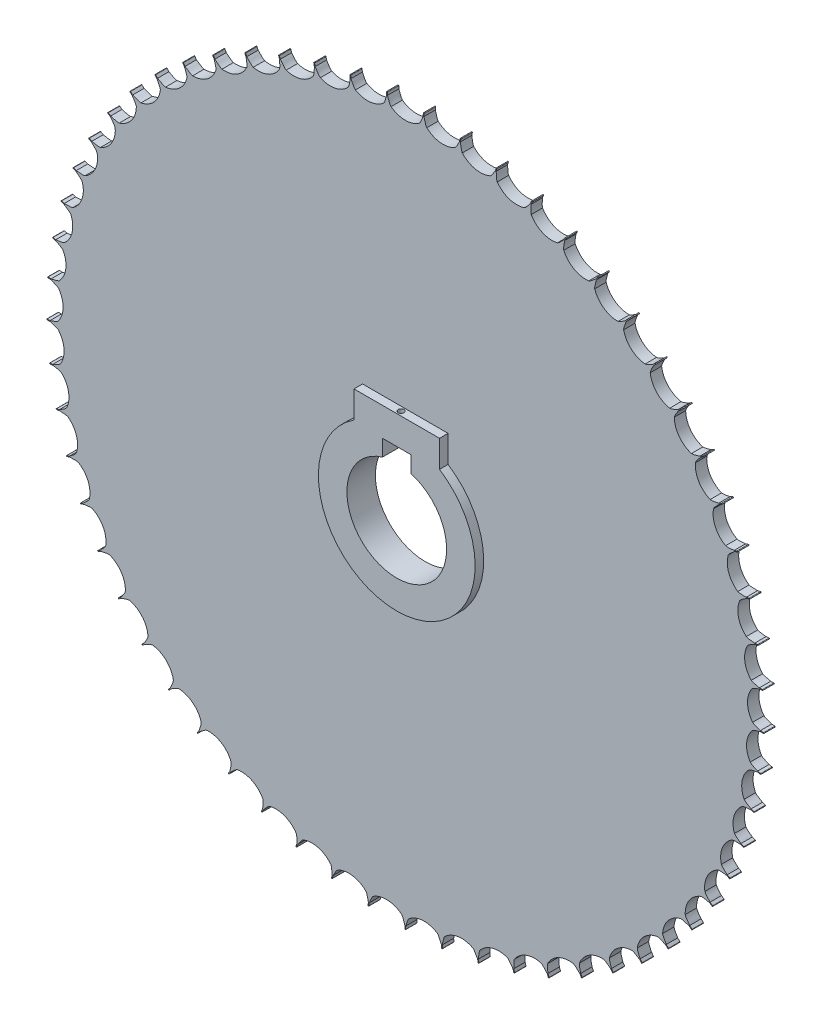
from build123d import *

# Parameters (mm, degrees)
BOSS_EXTRUDE1_DEPTH      = 2
BOSS_EXTRUDE1_DEPTH_BACK = 2
SKETCH1_R                = 121.875
BOSS_EXTRUDE8_DEPTH      = 13
SKETCH3_R                = 125.375
BOSS_EXTRUDE9_DEPTH      = 4
CUT_EXTRUDE1_REACH       = 179.783
CIRPATTERN1_COUNT        = 61
CUT_EXTRUDE4_REACH       = 178.802
BOSS_EXTRUDE12_START     = -7
BOSS_EXTRUDE12_DEPTH     = 10
SKETCH10_R               = 1
CUT_EXTRUDE5_DEPTH       = 10
SKETCH11_W               = 0.3
SKETCH11_H               = 1.7
BOSS_EXTRUDE13_DEPTH     = 4
FILLET1_RADIUS           = 0.15
FILLET1_LENGTH           = 4
CIRPATTERN2_START        = -2
CIRPATTERN2_DEPTH        = 4


with BuildPart() as part:
    # Sketch1 → Boss-Extrude1 (new, two sides: drawn at the far end of the back side and taken through both)
    with BuildSketch(Plane.XY.offset(-BOSS_EXTRUDE1_DEPTH_BACK)):
        Circle(SKETCH1_R)
    extrude(amount=BOSS_EXTRUDE1_DEPTH + BOSS_EXTRUDE1_DEPTH_BACK)

    # Sketch2 → Boss-Extrude8 (add)
    with BuildSketch(Plane.XY.offset(2)):
        with BuildLine():
            ThreePointArc((-5.017560557, 121.766793056), (0.002357444, 120.130259364), (5.022275444, 121.766793056))
            add(Edge.make_bspline(
                [(5.022275444, 121.766793056), (5.19040872, 121.981200196), (5.527488144, 122.5398233), (5.976227316, 123.731681771), (6.274832558, 124.706349674), (6.686666667, 125.196561909)],
                knots=[0.009720621, 0.009720621, 0.009720621, 0.009720621, 0.218523512, 0.511297045, 1, 1, 1, 1], degree=3))
            ThreePointArc((6.686666667, 125.196561909), (0, 125.375), (-6.686666667, 125.196561909))
            add(Edge.make_bspline(
                [(-5.017560557, 121.766793056), (-5.426604904, 122.281885542), (-5.896105794, 123.471658256), (-6.274769094, 124.705861977), (-6.686666667, 125.196561909)],
                knots=[0, 0, 0, 0, 0.507380155, 1, 1, 1, 1], degree=3))
        make_face()
    extrude(amount=-BOSS_EXTRUDE8_DEPTH)

    # Sketch3 → Boss-Extrude9 (add)
    with BuildSketch(Plane.XY.offset(2)):
        Circle(SKETCH3_R)
    extrude(amount=-BOSS_EXTRUDE9_DEPTH)

    # Sketch4 → Cut-Extrude1 (cut, up to next)
    with BuildSketch(Plane(origin=(0, 0, -11), x_dir=(-1, 0, 0), z_dir=(0, 0, -1)), mode=Mode.PRIVATE) as cut_extrude1_sk1:
        with BuildLine():
            ThreePointArc((6.686666667, 125.196561909), (0, 125.375), (-6.686666667, 125.196561909))
            add(Edge.make_bspline(
                [(-6.686666667, 125.196561909), (-6.274832558, 124.706349674), (-5.976227316, 123.731681771), (-5.527488144, 122.5398233), (-5.19040872, 121.981200196), (-5.022275444, 121.766793056)],
                knots=[0.009720621, 0.009720621, 0.009720621, 0.009720621, 0.498423576, 0.791197109, 1, 1, 1, 1], degree=3))
            ThreePointArc((-5.022275444, 121.766793056), (-0.002357444, 120.130259364), (5.017560557, 121.766793056))
            add(Edge.make_bspline(
                [(5.017560557, 121.766793056), (5.426604904, 122.281885542), (5.896105794, 123.471658256), (6.274769094, 124.705861977), (6.686666667, 125.196561909)],
                knots=[0, 0, 0, 0, 0.507380155, 1, 1, 1, 1], degree=3))
        make_face()
    cut_extrude1_tool1 = extrude(cut_extrude1_sk1.sketch, amount=-CUT_EXTRUDE1_REACH, mode=Mode.PRIVATE) & part.part
    cut_extrude1 = cut_extrude1_tool1.solids().sort_by_distance((0.000608, 123.088188, -11))[0]
    add(cut_extrude1, mode=Mode.SUBTRACT)

    # CirPattern1: Cut-Extrude1 ×61 about axis
    cirpattern1_axis = Axis((0, 0, 0), (0, 0, 1))
    for i in range(1, CIRPATTERN1_COUNT):
        add(cut_extrude1.rotate(cirpattern1_axis, i * 360 / CIRPATTERN1_COUNT), mode=Mode.SUBTRACT)

    # Sketch5 → Cut-Extrude4 (cut, up to next)
    with BuildSketch(Plane.XY.offset(2), mode=Mode.PRIVATE) as cut_extrude4_sk1:
        with BuildLine():
            Line((-5, 22.5), (5, 22.5))
            Line((5, 22.5), (5, 16.770509831))
            ThreePointArc((5, 16.770509831), (0, -17.5), (-5, 16.770509831))
            Line((-5, 16.770509831), (-5, 22.5))
        make_face()
    cut_extrude4_tool1 = extrude(cut_extrude4_sk1.sketch, amount=-CUT_EXTRUDE4_REACH, mode=Mode.PRIVATE) & part.part
    add(cut_extrude4_tool1.solids().sort_by_distance((0, 1.026754, 2))[0], mode=Mode.SUBTRACT)

    # Boss-Extrude12: read off the stored shape, not the designer's step
    # Boss-Extrude12 outline → Boss-Extrude12 (add)
    with BuildSketch(Plane.XY.offset(2).offset(BOSS_EXTRUDE12_START)):
        with BuildLine():
            ThreePointArc((-15, 23.048861143), (0, -27.5), (15, 23.048861143))
            Line((15, 23.048861143), (15, 32.5))
            Line((15, 32.5), (-15, 32.5))
            Line((-15, 32.5), (-15, 23.048861143))
        make_face()
        with BuildLine():
            Line((5, 22.5), (5, 16.770509831))
            ThreePointArc((5, 16.770509831), (0, -17.5), (-5, 16.770509831))
            Line((-5, 16.770509831), (-5, 22.5))
            Line((-5, 22.5), (5, 22.5))
        make_face(mode=Mode.SUBTRACT)
    extrude(amount=BOSS_EXTRUDE12_DEPTH)

    # Sketch10 → Cut-Extrude5 (cut)
    with BuildSketch(Plane(origin=(0, 32.5, 0), x_dir=(1, 0, 0), z_dir=(0, 1, 0))):
        with Locations(Location((0, -3.5, 0), (0, 0, 270))):
            Circle(SKETCH10_R)
    extrude(amount=-CUT_EXTRUDE5_DEPTH, mode=Mode.SUBTRACT)

    # Sketch11 → Boss-Extrude13 (add)
    with BuildSketch(Plane.XY.offset(2)):
        with Locations((-6.43520358, 124.840908899)):
            Rectangle(SKETCH11_W, SKETCH11_H)
    extrude(amount=-BOSS_EXTRUDE13_DEPTH)

    # Fillet1: full round fillet: the end face becomes a half cylinder, R = half its width
    fillet1_face = Plane((-6.43520358, 125.690908899, 0), x_dir=(0, 0, -1), z_dir=(0, 1, 0))  # on the end face: x along it, z out of the body
    fillet1_slab = fillet1_face.offset(-FILLET1_RADIUS / 2) * Box(FILLET1_LENGTH, 2 * FILLET1_RADIUS, FILLET1_RADIUS, mode=Mode.PRIVATE)  # the body's end, R deep
    fillet1_round = Plane((-6.43520358, 125.540908899, 0), x_dir=(0, 1, 0), z_dir=(0, 0, -1)) * Cylinder(FILLET1_RADIUS, FILLET1_LENGTH, mode=Mode.PRIVATE)  # its axis R under the face
    add(fillet1_slab - fillet1_round, mode=Mode.SUBTRACT)

    # CirPattern2: read off the stored shape, not the designer's step
    # CirPattern2 outline → CirPattern2 (add)
    with BuildSketch(Plane.XY.offset(CIRPATTERN2_START)):
        with BuildLine():
            Line((6.555554418, 124.546669502), (6.656350216, 125.521777366))
            ThreePointArc((6.656350216, 125.521777366), (6.522568384, 125.686405497), (6.357940253, 125.552623665))
            Line((6.357940253, 125.552623665), (6.24693583, 124.478756571))
            add(Edge.make_bspline(
                [(6.24693583, 124.478756571), (6.303416444, 124.602762202), (6.365316105, 124.723934482), (6.435170536, 124.840910603)],
                knots=[0.781331703, 0.781331703, 0.781331703, 0.781331703, 0.887572547, 0.887572547, 0.887572547, 0.887572547], degree=3))
            add(Edge.make_bspline(
                [(6.555554418, 124.546669502), (6.519654201, 124.646429724), (6.479946404, 124.744675326), (6.435170536, 124.840910603)],
                knots=[0.803239499, 0.803239499, 0.803239499, 0.803239499, 0.886693191, 0.886693191, 0.886693191, 0.886693191], degree=3))
        make_face()
        with BuildLine():
            Line((19.326821912, 123.21250802), (19.527345043, 124.172083767))
            ThreePointArc((19.527345043, 124.172083767), (19.411199499, 124.349594929), (19.233688337, 124.233449386))
            Line((19.233688337, 124.233449386), (19.012856166, 123.176687507))
            add(Edge.make_bspline(
                [(19.237330244, 123.517567597), (19.155818448, 123.408393967), (19.081787808, 123.294228499), (19.012856166, 123.176687507)],
                knots=[0.122148074, 0.122148074, 0.122148074, 0.122148074, 0.228388918, 0.228388918, 0.228388918, 0.228388918], degree=3))
            add(Edge.make_bspline(
                [(19.326821912, 123.21250802), (19.301369417, 123.315430796), (19.271973787, 123.41723848), (19.237330244, 123.517567597)],
                knots=[0.803239499, 0.803239499, 0.803239499, 0.803239499, 0.886693191, 0.886693191, 0.886693191, 0.886693191], degree=3))
        make_face()
        with BuildLine():
            Line((31.893220286, 120.5722633), (32.191345155, 121.506135189))
            ThreePointArc((32.191345155, 121.506135189), (32.094067072, 121.694647721), (31.90555454, 121.597369638))
            Line((31.90555454, 121.597369638), (31.577235497, 120.568914912))
            add(Edge.make_bspline(
                [(31.835569465, 120.884907647), (31.743264351, 120.784693775), (31.657887475, 120.678745303), (31.577235497, 120.568914912)],
                knots=[0.122148074, 0.122148074, 0.122148074, 0.122148074, 0.228388918, 0.228388918, 0.228388918, 0.228388918], degree=3))
            add(Edge.make_bspline(
                [(31.893220286, 120.5722633), (31.878485315, 120.677257625), (31.859713453, 120.781548203), (31.835569465, 120.884907647)],
                knots=[0.803239499, 0.803239499, 0.803239499, 0.803239499, 0.886693191, 0.886693191, 0.886693191, 0.886693191], degree=3))
        make_face()
        with BuildLine():
            Line((44.121542591, 116.653922596), (44.514109, 117.552191351))
            ThreePointArc((44.514109, 117.552191351), (44.436729549, 117.749706972), (44.239213928, 117.672327522))
            Line((44.239213928, 117.672327522), (43.806888276, 116.683081826))
            add(Edge.make_bspline(
                [(44.09634373, 116.970837603), (43.994223754, 116.880645781), (43.898405659, 116.784037385), (43.806888276, 116.683081826)],
                knots=[0.122148074, 0.122148074, 0.122148074, 0.122148074, 0.228388918, 0.228388918, 0.228388918, 0.228388918], degree=3))
            add(Edge.make_bspline(
                [(44.121542591, 116.653922596), (44.117681338, 116.759875502), (44.109732231, 116.865543468), (44.09634373, 116.970837603)],
                knots=[0.803239499, 0.803239499, 0.803239499, 0.803239499, 0.886693191, 0.886693191, 0.886693191, 0.886693191], degree=3))
        make_face()
        with BuildLine():
            Line((55.882165569, 111.499021291), (56.365012215, 112.352165041))
            ThreePointArc((56.365012215, 112.352165041), (56.308351639, 112.556590037), (56.103926643, 112.499929461))
            Line((56.103926643, 112.499929461), (55.572177142, 111.560379044))
            add(Edge.make_bspline(
                [(55.889685782, 111.816847582), (55.778833441, 111.737633865), (55.673589822, 111.651389618), (55.572177142, 111.560379044)],
                knots=[0.122148074, 0.122148074, 0.122148074, 0.122148074, 0.228388918, 0.228388918, 0.228388918, 0.228388918], degree=3))
            add(Edge.make_bspline(
                [(55.882165569, 111.499021291), (55.889218964, 111.604809651), (55.892176874, 111.7107349), (55.889685782, 111.816847582)],
                knots=[0.803239499, 0.803239499, 0.803239499, 0.803239499, 0.886693191, 0.886693191, 0.886693191, 0.886693191], degree=3))
        make_face()
        with BuildLine():
            Line((67.05042369, 105.162202624), (67.61843228, 105.961177831))
            ThreePointArc((67.61843228, 105.961177831), (67.583091194, 106.170345247), (67.373923778, 106.135004161))
            Line((67.373923778, 106.135004161), (66.748387105, 105.255108492))
            add(Edge.make_bspline(
                [(67.09058326, 105.47757116), (66.972173617, 105.410175234), (66.858620083, 105.335209345), (66.748387105, 105.255108492)],
                knots=[0.122148074, 0.122148074, 0.122148074, 0.122148074, 0.228388918, 0.228388918, 0.228388918, 0.228388918], degree=3))
            add(Edge.make_bspline(
                [(67.05042369, 105.162202624), (67.068316966, 105.266705055), (67.082150538, 105.371764752), (67.09058326, 105.47757116)],
                knots=[0.803239499, 0.803239499, 0.803239499, 0.803239499, 0.886693191, 0.886693191, 0.886693191, 0.886693191], degree=3))
        make_face()
        with BuildLine():
            Line((77.507930639, 97.710638447), (78.15508014, 98.446975777))
            ThreePointArc((78.15508014, 98.446975777), (78.141433169, 98.658668385), (77.929740561, 98.645021413))
            Line((77.929740561, 98.645021413), (77.21704756, 97.834107605))
            add(Edge.make_bspline(
                [(77.580303866, 98.020206243), (77.455592093, 97.965342522), (77.33493234, 97.902449649), (77.21704756, 97.834107605)],
                knots=[0.122148074, 0.122148074, 0.122148074, 0.122148074, 0.228388918, 0.228388918, 0.228388918, 0.228388918], degree=3))
            add(Edge.make_bspline(
                [(77.507930639, 97.710638447), (77.536474122, 97.812747198), (77.561036718, 97.915827683), (77.580303866, 98.020206243)],
                knots=[0.803239499, 0.803239499, 0.803239499, 0.803239499, 0.886693191, 0.886693191, 0.886693191, 0.886693191], degree=3))
        make_face()
        with BuildLine():
            Line((87.143834242, 89.223317195), (87.863264709, 89.889211288))
            ThreePointArc((87.863264709, 89.889211288), (87.871456513, 90.101185094), (87.659482707, 90.109376898))
            Line((87.659482707, 90.109376898), (86.867188101, 89.37604084))
            add(Edge.make_bspline(
                [(87.247653951, 89.523802756), (87.117962023, 89.482052808), (86.991475074, 89.431899632), (86.867188101, 89.37604084)],
                knots=[0.122148074, 0.122148074, 0.122148074, 0.122148074, 0.228388918, 0.228388918, 0.228388918, 0.228388918], degree=3))
            add(Edge.make_bspline(
                [(87.143834242, 89.223317195), (87.182725365, 89.321949888), (87.217756614, 89.421958483), (87.247653951, 89.523802756)],
                knots=[0.803239499, 0.803239499, 0.803239499, 0.803239499, 0.886693191, 0.886693191, 0.886693191, 0.886693191], degree=3))
        make_face()
        with BuildLine():
            Line((95.855991523, 79.790206585), (96.640076813, 80.378598799))
            ThreePointArc((96.640076813, 80.378598799), (96.670020558, 80.588606828), (96.460012529, 80.618550572))
            Line((96.460012529, 80.618550572), (95.596514838, 79.970565807))
            add(Edge.make_bspline(
                [(95.9901572, 80.078424689), (95.856859884, 80.050231074), (95.725886531, 80.01334923), (95.596514838, 79.970565807)],
                knots=[0.122148074, 0.122148074, 0.122148074, 0.122148074, 0.228388918, 0.228388918, 0.228388918, 0.228388918], degree=3))
            add(Edge.make_bspline(
                [(95.855991523, 79.790206585), (95.90481803, 79.884317688), (95.949946592, 79.980194277), (95.9901572, 80.078424689)],
                knots=[0.803239499, 0.803239499, 0.803239499, 0.803239499, 0.886693191, 0.886693191, 0.886693191, 0.886693191], degree=3))
        make_face()
        with BuildLine():
            Line((103.552051447, 69.511299935), (104.392480063, 70.015953166))
            ThreePointArc((104.392480063, 70.015953166), (104.443858337, 70.221769281), (104.238042222, 70.273147554))
            Line((104.238042222, 70.273147554), (103.312494737, 69.717382883))
            add(Edge.make_bspline(
                [(103.715140903, 69.784195399), (103.579651184, 69.769856977), (103.445579778, 69.746637422), (103.312494737, 69.717382883)],
                knots=[0.122148074, 0.122148074, 0.122148074, 0.122148074, 0.228388918, 0.228388918, 0.228388918, 0.228388918], degree=3))
            add(Edge.make_bspline(
                [(103.552051447, 69.511299935), (103.610295765, 69.599891847), (103.665043267, 69.690620115), (103.715140903, 69.784195399)],
                knots=[0.803239499, 0.803239499, 0.803239499, 0.803239499, 0.886693191, 0.886693191, 0.886693191, 0.886693191], degree=3))
        make_face()
        with BuildLine():
            Line((110.150433866, 58.495556214), (111.038297053, 58.911121011))
            ThreePointArc((111.038297053, 58.911121011), (111.110565234, 59.110563509), (110.911122736, 59.18283169))
            Line((110.911122736, 59.18283169), (109.93333649, 58.725178356))
            add(Edge.make_bspline(
                [(110.340718311, 58.750236277), (110.204472413, 58.749905038), (110.068724145, 58.740593906), (109.93333649, 58.725178356)],
                knots=[0.122148074, 0.122148074, 0.122148074, 0.122148074, 0.228388918, 0.228388918, 0.228388918, 0.228388918], degree=3))
            add(Edge.make_bspline(
                [(110.150433866, 58.495556214), (110.217478591, 58.577689839), (110.281264695, 58.662308043), (110.340718311, 58.750236277)],
                knots=[0.803239499, 0.803239499, 0.803239499, 0.803239499, 0.886693191, 0.886693191, 0.886693191, 0.886693191], degree=3))
        make_face()
        with BuildLine():
            Line((115.581194284, 46.859745045), (116.507080472, 47.181816319))
            ThreePointArc((116.507080472, 47.181816319), (116.599472499, 47.37277106), (116.408517758, 47.465163087))
            Line((116.408517758, 47.465163087), (115.388857528, 47.11047233))
            add(Edge.make_bspline(
                [(115.796656655, 47.093510036), (115.661098819, 47.107189492), (115.525112654, 47.111885481), (115.388857528, 47.11047233)],
                knots=[0.122148074, 0.122148074, 0.122148074, 0.122148074, 0.228388918, 0.228388918, 0.228388918, 0.228388918], degree=3))
            add(Edge.make_bspline(
                [(115.581194284, 46.859745045), (115.656328724, 46.934549746), (115.728477282, 47.012160912), (115.796656655, 47.093510036)],
                knots=[0.803239499, 0.803239499, 0.803239499, 0.803239499, 0.886693191, 0.886693191, 0.886693191, 0.886693191], degree=3))
        make_face()
        with BuildLine():
            Line((119.786765288, 34.727208921), (120.740859855, 34.952372636))
            ThreePointArc((120.740859855, 34.952372636), (120.85239635, 35.132815454), (120.671953532, 35.244351948))
            Line((120.671953532, 35.244351948), (119.621227971, 34.996383577))
            add(Edge.make_bspline(
                [(120.025121632, 34.937580872), (119.891688805, 34.965126017), (119.756906229, 34.983779351), (119.621227971, 34.996383577)],
                knots=[0.122148074, 0.122148074, 0.122148074, 0.122148074, 0.228388918, 0.228388918, 0.228388918, 0.228388918], degree=3))
            add(Edge.make_bspline(
                [(119.786765288, 34.727208921), (119.869193001, 34.79389175), (119.94893922, 34.86367318), (120.025121632, 34.937580872)],
                knots=[0.803239499, 0.803239499, 0.803239499, 0.803239499, 0.886693191, 0.886693191, 0.886693191, 0.886693191], degree=3))
        make_face()
        with BuildLine():
            Line((122.722566781, 22.226555743), (123.694756086, 22.352425108))
            ThreePointArc((123.694756086, 22.352425108), (123.824254734, 22.520443263), (123.656236579, 22.64994191))
            Line((123.656236579, 22.64994191), (122.58558364, 22.511324452))
            add(Edge.make_bspline(
                [(122.981290461, 22.41130466), (122.851397063, 22.452423509), (122.719246807, 22.484836456), (122.58558364, 22.511324452)],
                knots=[0.122148074, 0.122148074, 0.122148074, 0.122148074, 0.228388918, 0.228388918, 0.228388918, 0.228388918], degree=3))
            add(Edge.make_bspline(
                [(122.722566781, 22.226555743), (122.811414012, 22.284409845), (122.897912562, 22.34562184), (122.981290461, 22.41130466)],
                knots=[0.803239499, 0.803239499, 0.803239499, 0.803239499, 0.886693191, 0.886693191, 0.886693191, 0.886693191], degree=3))
        make_face()
        with BuildLine():
            Line((124.357478537, 9.490295545), (125.337457131, 9.515536313))
            ThreePointArc((125.337457131, 9.515536313), (125.483545214, 9.66934877), (125.329732757, 9.815436853))
            Line((125.329732757, 9.815436853), (124.250501625, 9.787639688))
            add(Edge.make_bspline(
                [(124.633827017, 9.647463044), (124.508849951, 9.701719726), (124.380732839, 9.747548702), (124.250501625, 9.787639688)],
                knots=[0.122148074, 0.122148074, 0.122148074, 0.122148074, 0.228388918, 0.228388918, 0.228388918, 0.228388918], degree=3))
            add(Edge.make_bspline(
                [(124.357478537, 9.490295545), (124.451803483, 9.538707653), (124.544137458, 9.590701349), (124.633827017, 9.647463044)],
                knots=[0.803239499, 0.803239499, 0.803239499, 0.803239499, 0.886693191, 0.886693191, 0.886693191, 0.886693191], degree=3))
        make_face()
        with BuildLine():
            Line((124.674170084, -3.346564146), (125.65154995, -3.422219534))
            ThreePointArc((125.65154995, -3.422219534), (125.812678898, -3.284243224), (125.674702589, -3.123114276))
            Line((125.674702589, -3.123114276), (124.598333384, -3.039796492))
            add(Edge.make_bspline(
                [(124.965214001, -3.218644082), (124.846478056, -3.1518247), (124.723752161, -3.093065494), (124.598333384, -3.039796492)],
                knots=[0.122148074, 0.122148074, 0.122148074, 0.122148074, 0.228388918, 0.228388918, 0.228388918, 0.228388918], degree=3))
            add(Edge.make_bspline(
                [(124.674170084, -3.346564146), (124.772972876, -3.308107214), (124.870163514, -3.265882962), (124.965214001, -3.218644082)],
                knots=[0.803239499, 0.803239499, 0.803239499, 0.803239499, 0.886693191, 0.886693191, 0.886693191, 0.886693191], degree=3))
        make_face()
        with BuildLine():
            Line((123.669284412, -16.147949425), (124.633705081, -16.323699002))
            ThreePointArc((124.633705081, -16.323699002), (124.808166888, -16.203021424), (124.687489309, -16.028559617))
            Line((124.687489309, -16.028559617), (123.625391813, -15.835010073))
            add(Edge.make_bspline(
                [(123.971938629, -16.050632779), (123.860702434, -15.971959), (123.744668682, -15.900892426), (123.625391813, -15.835010073)],
                knots=[0.122148074, 0.122148074, 0.122148074, 0.122148074, 0.228388918, 0.228388918, 0.228388918, 0.228388918], degree=3))
            add(Edge.make_bspline(
                [(123.669284412, -16.147949425), (123.771517718, -16.119855321), (123.872534773, -16.087848102), (123.971938629, -16.050632779)],
                knots=[0.803239499, 0.803239499, 0.803239499, 0.803239499, 0.886693191, 0.886693191, 0.886693191, 0.886693191], degree=3))
        make_face()
        with BuildLine():
            Line((121.35347356, -28.778162423), (122.294711933, -29.052143201))
            ThreePointArc((122.294711933, -29.052143201), (122.480657259, -28.950043565), (122.378557624, -28.764098239))
            Line((122.378557624, -28.764098239), (121.341990333, -28.462368607))
            add(Edge.make_bspline(
                [(121.664529867, -28.712480775), (121.561972554, -28.622786561), (121.453860932, -28.540165943), (121.341990333, -28.462368607)],
                knots=[0.122148074, 0.122148074, 0.122148074, 0.122148074, 0.228388918, 0.228388918, 0.228388918, 0.228388918], degree=3))
            add(Edge.make_bspline(
                [(121.35347356, -28.778162423), (121.458053681, -28.760728952), (121.561826347, -28.739278049), (121.664529867, -28.712480775)],
                knots=[0.803239499, 0.803239499, 0.803239499, 0.803239499, 0.886693191, 0.886693191, 0.886693191, 0.886693191], degree=3))
        make_face()
        with BuildLine():
            Line((117.7512857, -41.10331974), (118.659364415, -41.472627454))
            ThreePointArc((118.659364415, -41.472627454), (118.854822195, -41.390188043), (118.772382783, -41.194730263))
            Line((118.772382783, -41.194730263), (117.77233357, -40.788018954))
            add(Edge.make_bspline(
                [(118.067446822, -41.069969333), (117.974655524, -40.970205464), (117.875612041, -40.8769066), (117.77233357, -40.788018954)],
                knots=[0.122148074, 0.122148074, 0.122148074, 0.122148074, 0.228388918, 0.228388918, 0.228388918, 0.228388918], degree=3))
            add(Edge.make_bspline(
                [(117.7512857, -41.10331974), (117.85710406, -41.096731701), (117.962532321, -41.086064499), (118.067446822, -41.069969333)],
                knots=[0.803239499, 0.803239499, 0.803239499, 0.803239499, 0.886693191, 0.886693191, 0.886693191, 0.886693191], degree=3))
        make_face()
        with BuildLine():
            Line((112.900904918, -52.992771643), (113.766198116, -53.453491538))
            ThreePointArc((113.766198116, -53.453491538), (113.969096447, -53.39158623), (113.907191139, -53.188687899))
            Line((113.907191139, -53.188687899), (112.954260773, -52.681306153))
            add(Edge.make_bspline(
                [(113.218819468, -52.992105999), (113.136777797, -52.883329997), (113.047852338, -52.780341879), (112.954260773, -52.681306153)],
                knots=[0.122148074, 0.122148074, 0.122148074, 0.122148074, 0.228388918, 0.228388918, 0.228388918, 0.228388918], degree=3))
            add(Edge.make_bspline(
                [(112.900904918, -52.992771643), (113.006839816, -52.99709887), (113.112806107, -52.997328445), (113.218819468, -52.992105999)],
                knots=[0.803239499, 0.803239499, 0.803239499, 0.803239499, 0.886693191, 0.886693191, 0.886693191, 0.886693191], degree=3))
        make_face()
        with BuildLine():
            Line((106.853746457, -64.320486983), (107.667081814, -64.867735315))
            ThreePointArc((107.667081814, -64.867735315), (107.875269925, -64.827020322), (107.834554931, -64.618832211))
            Line((107.834554931, -64.618832211), (106.938844712, -64.016158401))
            add(Edge.make_bspline(
                [(107.170044463, -64.352513158), (107.09962208, -64.235878076), (107.021757278, -64.124292404), (106.938844712, -64.016158401)],
                knots=[0.122148074, 0.122148074, 0.122148074, 0.122148074, 0.228388918, 0.228388918, 0.228388918, 0.228388918], degree=3))
            add(Edge.make_bspline(
                [(106.853746457, -64.320486983), (106.958674957, -64.335683607), (107.064056008, -64.346807525), (107.170044463, -64.352513158)],
                knots=[0.803239499, 0.803239499, 0.803239499, 0.803239499, 0.886693191, 0.886693191, 0.886693191, 0.886693191], degree=3))
        make_face()
        with BuildLine():
            Line((99.673911702, -74.96638916), (100.426667661, -75.59436496))
            ThreePointArc((100.426667661, -75.59436496), (100.637938705, -75.575271871), (100.618845615, -75.364000827))
            Line((100.618845615, -75.364000827), (99.789850294, -74.672423445))
            add(Edge.make_bspline(
                [(99.985240326, -75.030767668), (99.927183725, -74.907509867), (99.861204967, -74.788509477), (99.789850294, -74.672423445)],
                knots=[0.122148074, 0.122148074, 0.122148074, 0.122148074, 0.228388918, 0.228388918, 0.228388918, 0.228388918], degree=3))
            add(Edge.make_bspline(
                [(99.673911702, -74.96638916), (99.776721536, -74.992294093), (99.880400282, -75.014194438), (99.985240326, -75.030767668)],
                knots=[0.803239499, 0.803239499, 0.803239499, 0.803239499, 0.886693191, 0.886693191, 0.886693191, 0.886693191], degree=3))
        make_face()
        with BuildLine():
            Line((91.437508687, -84.817628963), (92.121705848, -85.519675531))
            ThreePointArc((92.121705848, -85.519675531), (92.333820299, -85.522406736), (92.336551504, -85.310292285))
            Line((92.336551504, -85.310292285), (91.583058638, -84.537142224))
            add(Edge.make_bspline(
                [(91.740567768, -84.913677376), (91.695492365, -84.78510342), (91.642099041, -84.659949744), (91.583058638, -84.537142224)],
                knots=[0.122148074, 0.122148074, 0.122148074, 0.122148074, 0.228388918, 0.228388918, 0.228388918, 0.228388918], degree=3))
            add(Edge.make_bspline(
                [(91.437508687, -84.817628963), (91.537110045, -84.853967606), (91.637987465, -84.886412228), (91.740567768, -84.913677376)],
                knots=[0.803239499, 0.803239499, 0.803239499, 0.803239499, 0.886693191, 0.886693191, 0.886693191, 0.886693191], degree=3))
        make_face()
        with BuildLine():
            Line((82.231845332, -93.769780798), (82.840231035, -94.538456267))
            ThreePointArc((82.840231035, -94.538456267), (83.050940429, -94.562982816), (83.075466977, -94.352273422))
            Line((83.075466977, -94.352273422), (82.405463777, -93.505746265))
            add(Edge.make_bspline(
                [(82.523422369, -93.89648098), (82.491805973, -93.763953783), (82.451564067, -93.633973483), (82.405463777, -93.505746265)],
                knots=[0.122148074, 0.122148074, 0.122148074, 0.122148074, 0.228388918, 0.228388918, 0.228388918, 0.228388918], degree=3))
            add(Edge.make_bspline(
                [(82.231845332, -93.769780798), (82.327182415, -93.816167953), (82.424189184, -93.858812932), (82.523422369, -93.89648098)],
                knots=[0.803239499, 0.803239499, 0.803239499, 0.803239499, 0.886693191, 0.886693191, 0.886693191, 0.886693191], degree=3))
        make_face()
        with BuildLine():
            Line((72.154503961, -101.72794963), (72.680629166, -102.555105848))
            ThreePointArc((72.680629166, -102.555105848), (72.887699929, -102.601167753), (72.933761834, -102.39409699))
            Line((72.933761834, -102.39409699), (72.354350499, -101.483166134))
            add(Edge.make_bspline(
                [(72.431508164, -101.883958527), (72.413685918, -101.748882911), (72.387022002, -101.61545381), (72.354350499, -101.483166134)],
                knots=[0.122148074, 0.122148074, 0.122148074, 0.122148074, 0.228388918, 0.228388918, 0.228388918, 0.228388918], degree=3))
            add(Edge.make_bspline(
                [(72.154503961, -101.72794963), (72.244566171, -101.783893581), (72.336673994, -101.836286869), (72.431508164, -101.883958527)],
                knots=[0.803239499, 0.803239499, 0.803239499, 0.803239499, 0.886693191, 0.886693191, 0.886693191, 0.886693191], degree=3))
        make_face()
        with BuildLine():
            Line((61.312306897, -108.607776888), (61.750594546, -109.484645794))
            ThreePointArc((61.750594546, -109.484645794), (61.951831677, -109.551754787), (62.01894067, -109.350517656))
            Line((62.01894067, -109.350517656), (61.536263107, -108.384839196))
            add(Edge.make_bspline(
                [(61.571801953, -108.791440767), (61.567962776, -108.655248568), (61.555159496, -108.519785047), (61.536263107, -108.384839196)],
                knots=[0.122148074, 0.122148074, 0.122148074, 0.122148074, 0.228388918, 0.228388918, 0.228388918, 0.228388918], degree=3))
            add(Edge.make_bspline(
                [(61.312306897, -108.607776888), (61.396139554, -108.672684616), (61.482372063, -108.734270831), (61.571801953, -108.791440767)],
                knots=[0.803239499, 0.803239499, 0.803239499, 0.803239499, 0.886693191, 0.886693191, 0.886693191, 0.886693191], degree=3))
        make_face()
        with BuildLine():
            Line((49.820184128, -114.336334694), (50.165988262, -115.253621258))
            ThreePointArc((50.165988262, -115.253621258), (50.359258598, -115.341065968), (50.446703308, -115.147795632))
            Line((50.446703308, -115.147795632), (50.065876018, -114.137606))
            add(Edge.make_bspline(
                [(50.059419324, -114.545706671), (50.069603914, -114.40984156), (50.070796986, -114.273779566), (50.065876018, -114.137606)],
                knots=[0.122148074, 0.122148074, 0.122148074, 0.122148074, 0.228388918, 0.228388918, 0.228388918, 0.228388918], degree=3))
            add(Edge.make_bspline(
                [(49.820184128, -114.336334694), (49.896898584, -114.40951816), (49.976341694, -114.479644472), (50.059419324, -114.545706671)],
                knots=[0.803239499, 0.803239499, 0.803239499, 0.803239499, 0.886693191, 0.886693191, 0.886693191, 0.886693191], degree=3))
        make_face()
        with BuildLine():
            Line((37.799955013, -118.852898907), (38.049610023, -119.800879665))
            ThreePointArc((38.049610023, -119.800879665), (38.232864849, -119.907733155), (38.33971834, -119.724478329))
            Line((38.33971834, -119.724478329), (38.064778188, -118.680485786))
            add(Edge.make_bspline(
                [(38.016394398, -119.085759589), (38.040494793, -118.95166177), (38.055671573, -118.816443594), (38.064778188, -118.680485786)],
                knots=[0.122148074, 0.122148074, 0.122148074, 0.122148074, 0.228388918, 0.228388918, 0.228388918, 0.228388918], degree=3))
            add(Edge.make_bspline(
                [(37.799955013, -118.852898907), (37.868738076, -118.933582349), (37.94054967, -119.011505403), (38.016394398, -119.085759589)],
                knots=[0.803239499, 0.803239499, 0.803239499, 0.803239499, 0.886693191, 0.886693191, 0.886693191, 0.886693191], degree=3))
        make_face()
        with BuildLine():
            Line((25.379036971, -122.109592826), (25.529896452, -123.078218944))
            ThreePointArc((25.529896452, -123.078218944), (25.701193223, -123.203348542), (25.826322821, -123.032051771))
            Line((25.826322821, -123.032051771), (25.660184239, -121.965322898))
            add(Edge.make_bspline(
                [(25.570386233, -122.363473831), (25.608146965, -122.232564772), (25.637146573, -122.099623762), (25.660184239, -121.965322898)],
                knots=[0.122148074, 0.122148074, 0.122148074, 0.122148074, 0.228388918, 0.228388918, 0.228388918, 0.228388918], degree=3))
            add(Edge.make_bspline(
                [(25.379036971, -122.109592826), (25.439159523, -122.196920978), (25.502578381, -122.28181477), (25.570386233, -122.363473831)],
                knots=[0.803239499, 0.803239499, 0.803239499, 0.803239499, 0.886693191, 0.886693191, 0.886693191, 0.886693191], degree=3))
        make_face()
        with BuildLine():
            Line((12.689094824, -124.071894683), (12.739559627, -125.050898485))
            ThreePointArc((12.739559627, -125.050898485), (12.897082554, -125.192977785), (13.039161854, -125.035454858))
            Line((13.039161854, -125.035454858), (12.983585955, -123.957297246))
            add(Edge.make_bspline(
                [(12.853325613, -124.344104809), (12.904346408, -124.217772181), (12.946861442, -124.088517543), (12.983585955, -123.957297246)],
                knots=[0.122148074, 0.122148074, 0.122148074, 0.122148074, 0.228388918, 0.228388918, 0.228388918, 0.228388918], degree=3))
            add(Edge.make_bspline(
                [(12.689094824, -124.071894683), (12.739919552, -124.164941846), (12.794273417, -124.255906481), (12.853325613, -124.344104809)],
                knots=[0.803239499, 0.803239499, 0.803239499, 0.803239499, 0.886693191, 0.886693191, 0.886693191, 0.886693191], degree=3))
        make_face()
        with BuildLine():
            Line((-0.135354885, -124.719003591), (-0.185819698, -125.698007392))
            ThreePointArc((-0.185819698, -125.698007392), (-0.043740398, -125.855530319), (0.113782529, -125.713451019))
            Line((0.113782529, -125.713451019), (0.169358429, -124.635293407))
            add(Edge.make_bspline(
                [(1.6544e-05, -125.006657343), (0.063756569, -124.886240303), (0.119336359, -124.762042169), (0.169358429, -124.635293407)],
                knots=[0.122148074, 0.122148074, 0.122148074, 0.122148074, 0.228388918, 0.228388918, 0.228388918, 0.228388918], degree=3))
            add(Edge.make_bspline(
                [(-0.135354885, -124.719003591), (-0.094366737, -124.816783442), (-0.049654028, -124.912854671), (1.6544e-05, -125.006657343)],
                knots=[0.803239499, 0.803239499, 0.803239499, 0.803239499, 0.886693191, 0.886693191, 0.886693191, 0.886693191], degree=3))
        make_face()
        with BuildLine():
            Line((-12.958369798, -124.044060034), (-13.109229289, -125.012686151))
            ThreePointArc((-13.109229289, -125.012686151), (-12.984099691, -125.183982922), (-12.81280292, -125.058853324))
            Line((-12.81280292, -125.058853324), (-12.646664338, -123.992124451))
            add(Edge.make_bspline(
                [(-12.853292701, -124.344108211), (-12.777509105, -124.230883209), (-12.709453719, -124.11305811), (-12.646664338, -123.992124451)],
                knots=[0.122148074, 0.122148074, 0.122148074, 0.122148074, 0.228388918, 0.228388918, 0.228388918, 0.228388918], degree=3))
            add(Edge.make_bspline(
                [(-12.958369798, -124.044060034), (-12.927652714, -124.145536082), (-12.893055128, -124.245695527), (-12.853292701, -124.344108211)],
                knots=[0.803239499, 0.803239499, 0.803239499, 0.803239499, 0.886693191, 0.886693191, 0.886693191, 0.886693191], degree=3))
        make_face()
        with BuildLine():
            Line((-25.644022768, -122.054218583), (-25.893677788, -123.002199338))
            ThreePointArc((-25.893677788, -123.002199338), (-25.786824298, -123.185454165), (-25.603569471, -123.078600674))
            Line((-25.603569471, -123.078600674), (-25.328629318, -122.034608131))
            add(Edge.make_bspline(
                [(-25.570353845, -122.363480599), (-25.483330004, -122.258647848), (-25.403520426, -122.14844476), (-25.328629318, -122.034608131)],
                knots=[0.122148074, 0.122148074, 0.122148074, 0.122148074, 0.228388918, 0.228388918, 0.228388918, 0.228388918], degree=3))
            add(Edge.make_bspline(
                [(-25.644022768, -122.054218583), (-25.623902357, -122.158315156), (-25.599786636, -122.261501102), (-25.570353845, -122.363480599)],
                knots=[0.803239499, 0.803239499, 0.803239499, 0.803239499, 0.886693191, 0.886693191, 0.886693191, 0.886693191], degree=3))
        make_face()
        with BuildLine():
            Line((-38.057842718, -118.770572051), (-38.403646861, -119.687858612))
            ThreePointArc((-38.403646861, -119.687858612), (-38.316202151, -119.881128948), (-38.122931815, -119.793684238))
            Line((-38.122931815, -119.793684238), (-37.742104525, -118.783494606))
            add(Edge.make_bspline(
                [(-38.016362878, -119.085769652), (-37.919021266, -118.990440406), (-37.828303497, -118.889027508), (-37.742104525, -118.783494606)],
                knots=[0.122148074, 0.122148074, 0.122148074, 0.122148074, 0.228388918, 0.228388918, 0.228388918, 0.228388918], degree=3))
            add(Edge.make_bspline(
                [(-38.057842718, -118.770572051), (-38.04853226, -118.8761857), (-38.035154038, -118.981304351), (-38.016362878, -119.085769652)],
                knots=[0.803239499, 0.803239499, 0.803239499, 0.803239499, 0.886693191, 0.886693191, 0.886693191, 0.886693191], degree=3))
        make_face()
        with BuildLine():
            Line((-50.068240066, -114.227927909), (-50.506527724, -115.10479681))
            ThreePointArc((-50.506527724, -115.10479681), (-50.43941873, -115.306033941), (-50.238181599, -115.238924948))
            Line((-50.238181599, -115.238924948), (-49.755504035, -114.273246488))
            add(Edge.make_bspline(
                [(-50.059389006, -114.545719921), (-49.952761469, -114.460904694), (-49.852097141, -114.369356988), (-49.755504035, -114.273246488)],
                knots=[0.122148074, 0.122148074, 0.122148074, 0.122148074, 0.228388918, 0.228388918, 0.228388918, 0.228388918], degree=3))
            add(Edge.make_bspline(
                [(-50.068240066, -114.227927909), (-50.069838256, -114.333939103), (-50.067339344, -114.439876174), (-50.059389006, -114.545719921)],
                knots=[0.803239499, 0.803239499, 0.803239499, 0.803239499, 0.886693191, 0.886693191, 0.886693191, 0.886693191], degree=3))
        make_face()
        with BuildLine():
            Line((-61.547901615, -108.474439314), (-62.074026828, -109.301595527))
            ThreePointArc((-62.074026828, -109.301595527), (-62.027964923, -109.50866629), (-61.82089416, -109.462604385))
            Line((-61.82089416, -109.462604385), (-61.241482825, -108.55167353))
            add(Edge.make_bspline(
                [(-61.571773158, -108.791457064), (-61.456989974, -108.718054918), (-61.347446152, -108.637342833), (-61.241482825, -108.55167353)],
                knots=[0.122148074, 0.122148074, 0.122148074, 0.122148074, 0.228388918, 0.228388918, 0.228388918, 0.228388918], degree=3))
            add(Edge.make_bspline(
                [(-61.547901615, -108.474439314), (-61.560391511, -108.579724308), (-61.568798399, -108.68535684), (-61.571773158, -108.791457064)],
                knots=[0.803239499, 0.803239499, 0.803239499, 0.803239499, 0.886693191, 0.886693191, 0.886693191, 0.886693191], degree=3))
        make_face()
        with BuildLine():
            Line((-72.375140094, -101.571094677), (-72.983525805, -102.33977014))
            ThreePointArc((-72.983525805, -102.33977014), (-72.958999257, -102.550479534), (-72.748289863, -102.525952985))
            Line((-72.748289863, -102.525952985), (-72.078286662, -101.679425828))
            add(Edge.make_bspline(
                [(-72.431481197, -101.883977698), (-72.309759096, -101.822766714), (-72.192496973, -101.753745818), (-72.078286662, -101.679425828)],
                knots=[0.122148074, 0.122148074, 0.122148074, 0.122148074, 0.228388918, 0.228388918, 0.228388918, 0.228388918], degree=3))
            add(Edge.make_bspline(
                [(-72.375140094, -101.571094677), (-72.398389301, -101.674537424), (-72.417612873, -101.778745686), (-72.431481197, -101.883977698)],
                knots=[0.803239499, 0.803239499, 0.803239499, 0.803239499, 0.886693191, 0.886693191, 0.886693191, 0.886693191], degree=3))
        make_face()
        with BuildLine():
            Line((-82.435184085, -93.591071169), (-83.119381253, -94.293117731))
            ThreePointArc((-83.119381253, -94.293117731), (-83.116650048, -94.505232183), (-82.904535596, -94.502500978))
            Line((-82.904535596, -94.502500978), (-82.151042729, -93.729350917))
            add(Edge.make_bspline(
                [(-82.523397516, -93.896502823), (-82.396026784, -93.848131852), (-82.272289367, -93.791533784), (-82.151042729, -93.729350917)],
                knots=[0.122148074, 0.122148074, 0.122148074, 0.122148074, 0.228388918, 0.228388918, 0.228388918, 0.228388918], degree=3))
            add(Edge.make_bspline(
                [(-82.435184085, -93.591071169), (-82.468946154, -93.69157515), (-82.498782636, -93.793254508), (-82.523397516, -93.896502823)],
                knots=[0.803239499, 0.803239499, 0.803239499, 0.803239499, 0.886693191, 0.886693191, 0.886693191, 0.886693191], degree=3))
        make_face()
        with BuildLine():
            Line((-91.621394616, -84.618959024), (-92.374150582, -85.246934817))
            ThreePointArc((-92.374150582, -85.246934817), (-92.393243672, -85.458205861), (-92.181972628, -85.477298951))
            Line((-92.181972628, -85.477298951), (-91.352977307, -84.785721569))
            add(Edge.make_bspline(
                [(-91.740545293, -84.913701659), (-91.608876089, -84.878683446), (-91.479975027, -84.835108159), (-91.352977307, -84.785721569)],
                knots=[0.122148074, 0.122148074, 0.122148074, 0.122148074, 0.228388918, 0.228388918, 0.228388918, 0.228388918], degree=3))
            add(Edge.make_bspline(
                [(-91.621394616, -84.618959024), (-91.665311661, -84.715458872), (-91.70544478, -84.813531499), (-91.740545293, -84.913701659)],
                knots=[0.803239499, 0.803239499, 0.803239499, 0.803239499, 0.886693191, 0.886693191, 0.886693191, 0.886693191], degree=3))
        make_face()
        with BuildLine():
            Line((-99.836395572, -74.749864862), (-100.649730934, -75.297113186))
            ThreePointArc((-100.649730934, -75.297113186), (-100.690445928, -75.505301296), (-100.482257818, -75.54601629))
            Line((-100.482257818, -75.54601629), (-99.586547599, -74.943342481))
            add(Edge.make_bspline(
                [(-99.985220467, -75.030794133), (-99.850648519, -75.00949988), (-99.717950193, -74.979409283), (-99.586547599, -74.943342481)],
                knots=[0.122148074, 0.122148074, 0.122148074, 0.122148074, 0.228388918, 0.228388918, 0.228388918, 0.228388918], degree=3))
            add(Edge.make_bspline(
                [(-99.836395572, -74.749864862), (-99.890002062, -74.841337654), (-99.940006395, -74.934763957), (-99.985220467, -75.030794133)],
                knots=[0.803239499, 0.803239499, 0.803239499, 0.803239499, 0.886693191, 0.886693191, 0.886693191, 0.886693191], degree=3))
        make_face()
        with BuildLine():
            Line((-106.993105898, -64.088403537), (-107.8583991, -64.549123424))
            ThreePointArc((-107.8583991, -64.549123424), (-107.920304409, -64.752021755), (-107.717406078, -64.813927064))
            Line((-107.717406078, -64.813927064), (-106.764475712, -64.306545318))
            add(Edge.make_bspline(
                [(-107.17002743, -64.352541524), (-107.033979234, -64.345196955), (-106.898890281, -64.328910016), (-106.764475712, -64.306545318)],
                knots=[0.122148074, 0.122148074, 0.122148074, 0.122148074, 0.228388918, 0.228388918, 0.228388918, 0.228388918], degree=3))
            add(Edge.make_bspline(
                [(-106.993105898, -64.088403537), (-107.055833591, -64.173879639), (-107.11517908, -64.261669276), (-107.17002743, -64.352541524)],
                knots=[0.803239499, 0.803239499, 0.803239499, 0.803239499, 0.886693191, 0.886693191, 0.886693191, 0.886693191], degree=3))
        make_face()
        with BuildLine():
            Line((-113.015662685, -52.747589192), (-113.923741404, -53.116896896))
            ThreePointArc((-113.923741404, -53.116896896), (-114.006180815, -53.312354675), (-113.810723036, -53.394794086))
            Line((-113.810723036, -53.394794086), (-112.810673823, -52.988082778))
            add(Edge.make_bspline(
                [(-113.218805442, -52.992135966), (-113.082723143, -52.998818935), (-112.946675539, -52.9965083), (-112.810673823, -52.988082778)],
                knots=[0.122148074, 0.122148074, 0.122148074, 0.122148074, 0.228388918, 0.228388918, 0.228388918, 0.228388918], degree=3))
            add(Edge.make_bspline(
                [(-113.015662685, -52.747589192), (-113.086846651, -52.826162536), (-113.154904221, -52.907384914), (-113.218805442, -52.992135966)],
                knots=[0.803239499, 0.803239499, 0.803239499, 0.803239499, 0.886693191, 0.886693191, 0.886693191, 0.886693191], degree=3))
        make_face()
        with BuildLine():
            Line((-117.840225333, -40.847637278), (-118.781463708, -41.121618047))
            ThreePointArc((-118.781463708, -41.121618047), (-118.883563344, -41.307563374), (-118.697618017, -41.409663009))
            Line((-118.697618017, -41.409663009), (-117.661050727, -41.107933378))
            add(Edge.make_bspline(
                [(-118.067435951, -41.070000583), (-117.932762054, -41.09064025), (-117.797197938, -41.102330412), (-117.661050727, -41.107933378)],
                knots=[0.122148074, 0.122148074, 0.122148074, 0.122148074, 0.228388918, 0.228388918, 0.228388918, 0.228388918], degree=3))
            add(Edge.make_bspline(
                [(-117.840225333, -40.847637278), (-117.919111005, -40.918474968), (-117.995159226, -40.99226911), (-118.067435951, -41.070000583)],
                knots=[0.803239499, 0.803239499, 0.803239499, 0.803239499, 0.886693191, 0.886693191, 0.886693191, 0.886693191], degree=3))
        make_face()
        with BuildLine():
            Line((-121.415652276, -28.514690248), (-122.380072947, -28.690439816))
            ThreePointArc((-122.380072947, -28.690439816), (-122.500750526, -28.864901623), (-122.326288719, -28.985579202))
            Line((-122.326288719, -28.985579202), (-121.264191223, -28.792029658))
            add(Edge.make_bspline(
                [(-121.664522267, -28.712512978), (-121.53268435, -28.746890556), (-121.399040734, -28.772457596), (-121.264191223, -28.792029658)],
                knots=[0.122148074, 0.122148074, 0.122148074, 0.122148074, 0.228388918, 0.228388918, 0.228388918, 0.228388918], degree=3))
            add(Edge.make_bspline(
                [(-121.415652276, -28.514690248), (-121.501403446, -28.577041386), (-121.58463619, -28.642625056), (-121.664522267, -28.712512978)],
                knots=[0.803239499, 0.803239499, 0.803239499, 0.803239499, 0.886693191, 0.886693191, 0.886693191, 0.886693191], degree=3))
        make_face()
        with BuildLine():
            Line((-123.704043101, -15.879480408), (-124.681422968, -15.955135786))
            ThreePointArc((-124.681422968, -15.955135786), (-124.819399278, -16.116264734), (-124.65827033, -16.254241044))
            Line((-124.65827033, -16.254241044), (-123.581901125, -16.170923261))
            add(Edge.make_bspline(
                [(-123.97193438, -16.050665592), (-123.844329957, -16.098416671), (-123.714023498, -16.137589572), (-123.581901125, -16.170923261)],
                knots=[0.122148074, 0.122148074, 0.122148074, 0.122148074, 0.228388918, 0.228388918, 0.228388918, 0.228388918], degree=3))
            add(Edge.make_bspline(
                [(-123.704043101, -15.879480408), (-123.795750786, -15.932684056), (-123.885285764, -15.989362051), (-123.97193438, -16.050665592)],
                knots=[0.803239499, 0.803239499, 0.803239499, 0.803239499, 0.886693191, 0.886693191, 0.886693191, 0.886693191], degree=3))
        make_face()
        with BuildLine():
            Line((-124.681140295, -3.075944125), (-125.661118889, -3.050703348))
            ThreePointArc((-125.661118889, -3.050703348), (-125.814931346, -3.196791431), (-125.668843263, -3.350603888))
            Line((-125.668843263, -3.350603888), (-124.589612132, -3.378401054))
            add(Edge.make_bspline(
                [(-124.965213149, -3.218677158), (-124.843194858, -3.279295564), (-124.717606836, -3.331659084), (-124.589612132, -3.378401054)],
                knots=[0.122148074, 0.122148074, 0.122148074, 0.122148074, 0.228388918, 0.228388918, 0.228388918, 0.228388918], degree=3))
            add(Edge.make_bspline(
                [(-124.681140295, -3.075944125), (-124.77783237, -3.119436312), (-124.87272049, -3.16660783), (-124.965213149, -3.218677158)],
                knots=[0.803239499, 0.803239499, 0.803239499, 0.803239499, 0.886693191, 0.886693191, 0.886693191, 0.886693191], degree=3))
        make_face()
        with BuildLine():
            Line((-124.336586386, 9.760197931), (-125.308775689, 9.886067305))
            ThreePointArc((-125.308775689, 9.886067305), (-125.476793843, 9.756568657), (-125.347295195, 9.588550503))
            Line((-125.347295195, 9.588550503), (-124.276642255, 9.449933044))
            add(Edge.make_bspline(
                [(-124.63382957, 9.647430055), (-124.518690837, 9.574586892), (-124.399152516, 9.509587819), (-124.276642255, 9.449933044)],
                knots=[0.122148074, 0.122148074, 0.122148074, 0.122148074, 0.228388918, 0.228388918, 0.228388918, 0.228388918], degree=3))
            add(Edge.make_bspline(
                [(-124.336586386, 9.760197931), (-124.43723789, 9.726878234), (-124.536473313, 9.689713221), (-124.63382957, 9.647430055)],
                knots=[0.803239499, 0.803239499, 0.803239499, 0.803239499, 0.886693191, 0.886693191, 0.886693191, 0.886693191], degree=3))
        make_face()
        with BuildLine():
            Line((-122.674033729, 22.49287946), (-123.628128293, 22.718043185))
            ThreePointArc((-123.628128293, 22.718043185), (-123.80857111, 22.60650669), (-123.697034615, 22.426063873))
            Line((-123.697034615, 22.426063873), (-122.646309055, 22.178095501))
            add(Edge.make_bspline(
                [(-122.981296393, 22.411272109), (-122.874257716, 22.326976344), (-122.762036233, 22.250030725), (-122.646309055, 22.178095501)],
                knots=[0.122148074, 0.122148074, 0.122148074, 0.122148074, 0.228388918, 0.228388918, 0.228388918, 0.228388918], degree=3))
            add(Edge.make_bspline(
                [(-122.674033729, 22.49287946), (-122.777577732, 22.47008545), (-122.880108539, 22.443320902), (-122.981296393, 22.411272109)],
                knots=[0.803239499, 0.803239499, 0.803239499, 0.803239499, 0.886693191, 0.886693191, 0.886693191, 0.886693191], degree=3))
        make_face()
        with BuildLine():
            Line((-119.711105796, 34.987130872), (-120.636991982, 35.309202155))
            ThreePointArc((-120.636991982, 35.309202155), (-120.827946724, 35.216810129), (-120.735554697, 35.025855387))
            Line((-120.735554697, 35.025855387), (-119.715894467, 34.671164628))
            add(Edge.make_bspline(
                [(-120.025130879, 34.937549104), (-119.927326895, 34.842694293), (-119.823611825, 34.754617771), (-119.715894467, 34.671164628)],
                knots=[0.122148074, 0.122148074, 0.122148074, 0.122148074, 0.228388918, 0.228388918, 0.228388918, 0.228388918], degree=3))
            add(Edge.make_bspline(
                [(-119.711105796, 34.987130872), (-119.816444706, 34.975104171), (-119.921184045, 34.959023798), (-120.025130879, 34.937549104)],
                knots=[0.803239499, 0.803239499, 0.803239499, 0.803239499, 0.886693191, 0.886693191, 0.886693191, 0.886693191], degree=3))
        make_face()
        with BuildLine():
            Line((-115.479210362, 47.110509993), (-116.367073545, 47.526074799))
            ThreePointArc((-116.367073545, 47.526074799), (-116.566516043, 47.453806618), (-116.494247863, 47.25436412))
            Line((-116.494247863, 47.25436412), (-115.516461617, 46.796710786))
            add(Edge.make_bspline(
                [(-115.79666912, 47.093479386), (-115.709136575, 46.989071015), (-115.615027324, 46.890797222), (-115.516461617, 46.796710786)],
                knots=[0.122148074, 0.122148074, 0.122148074, 0.122148074, 0.228388918, 0.228388918, 0.228388918, 0.228388918], degree=3))
            add(Edge.make_bspline(
                [(-115.479210362, 47.110509993), (-115.58522756, 47.109378086), (-115.691065167, 47.104152344), (-115.79666912, 47.093479386)],
                knots=[0.803239499, 0.803239499, 0.803239499, 0.803239499, 0.886693191, 0.886693191, 0.886693191, 0.886693191], degree=3))
        make_face()
        with BuildLine():
            Line((-110.02320657, 58.734505989), (-110.86363518, 59.239159227))
            ThreePointArc((-110.86363518, 59.239159227), (-111.069451295, 59.187780954), (-111.018073021, 58.981964839))
            Line((-111.018073021, 58.981964839), (-110.092525536, 58.426200167))
            add(Edge.make_bspline(
                [(-110.340733861, 58.750207072), (-110.264400623, 58.637351894), (-110.180894771, 58.529922558), (-110.092525536, 58.426200167)],
                knots=[0.122148074, 0.122148074, 0.122148074, 0.122148074, 0.228388918, 0.228388918, 0.228388918, 0.228388918], degree=3))
            add(Edge.make_bspline(
                [(-110.02320657, 58.734505989), (-110.128778248, 58.744280875), (-110.234592218, 58.749965158), (-110.340733861, 58.750207072)],
                knots=[0.803239499, 0.803239499, 0.803239499, 0.803239499, 0.886693191, 0.886693191, 0.886693191, 0.886693191], degree=3))
        make_face()
        with BuildLine():
            Line((-103.400929418, 69.735901609), (-104.185014703, 70.32429383))
            ThreePointArc((-104.185014703, 70.32429383), (-104.395022732, 70.294350086), (-104.365078987, 70.084342057))
            Line((-104.365078987, 70.084342057), (-103.501581296, 69.436357292))
            add(Edge.make_bspline(
                [(-103.715159373, 69.784167947), (-103.650834593, 69.664062257), (-103.578817324, 69.548616154), (-103.501581296, 69.436357292)],
                knots=[0.122148074, 0.122148074, 0.122148074, 0.122148074, 0.228388918, 0.228388918, 0.228388918, 0.228388918], degree=3))
            add(Edge.make_bspline(
                [(-103.400929418, 69.735901609), (-103.504936489, 69.756479672), (-103.609605169, 69.773013726), (-103.715159373, 69.784167947)],
                knots=[0.803239499, 0.803239499, 0.803239499, 0.803239499, 0.886693191, 0.886693191, 0.886693191, 0.886693191], degree=3))
        make_face()
        with BuildLine():
            Line((-95.682576691, 79.998079324), (-96.402007151, 80.663973424))
            ThreePointArc((-96.402007151, 80.663973424), (-96.613980957, 80.65578162), (-96.605789153, 80.443807814))
            Line((-96.605789153, 80.443807814), (-95.813494547, 79.710471755))
            add(Edge.make_bspline(
                [(-95.990178395, 80.078399282), (-95.938543931, 79.952316228), (-95.878778646, 79.830077117), (-95.813494547, 79.710471755)],
                knots=[0.122148074, 0.122148074, 0.122148074, 0.122148074, 0.228388918, 0.228388918, 0.228388918, 0.228388918], degree=3))
            add(Edge.make_bspline(
                [(-95.682576691, 79.998079324), (-95.783916654, 80.029242432), (-95.886330529, 80.056450991), (-95.990178395, 80.078399282)],
                knots=[0.803239499, 0.803239499, 0.803239499, 0.803239499, 0.886693191, 0.886693191, 0.886693191, 0.886693191], degree=3))
        make_face()
        with BuildLine():
            Line((-86.949964847, 89.412257497), (-87.597114342, 90.148594833))
            ThreePointArc((-87.597114342, 90.148594833), (-87.80880695, 90.162241805), (-87.822453921, 89.950549197))
            Line((-87.822453921, 89.950549197), (-87.10976092, 89.139635389))
            add(Edge.make_bspline(
                [(-87.247677647, 89.523779663), (-87.209280837, 89.393055758), (-87.162401063, 89.265319403), (-87.10976092, 89.139635389)],
                knots=[0.122148074, 0.122148074, 0.122148074, 0.122148074, 0.228388918, 0.228388918, 0.228388918, 0.228388918], degree=3))
            add(Edge.make_bspline(
                [(-86.949964847, 89.412257497), (-87.047563475, 89.453675312), (-87.146636932, 89.49126996), (-87.247677647, 89.523779663)],
                knots=[0.803239499, 0.803239499, 0.803239499, 0.803239499, 0.886693191, 0.886693191, 0.886693191, 0.886693191], degree=3))
        make_face()
        with BuildLine():
            Line((-77.295661747, 97.878643497), (-77.863670329, 98.67761871))
            ThreePointArc((-77.863670329, 98.67761871), (-78.072837744, 98.712959796), (-78.10817883, 98.503792381))
            Line((-78.10817883, 98.503792381), (-77.482642157, 97.623896712))
            add(Edge.make_bspline(
                [(-77.58032981, 98.020185709), (-77.55557767, 97.886206659), (-77.522080345, 97.754327097), (-77.482642157, 97.623896712)],
                knots=[0.122148074, 0.122148074, 0.122148074, 0.122148074, 0.228388918, 0.228388918, 0.228388918, 0.228388918], degree=3))
            add(Edge.make_bspline(
                [(-77.295661747, 97.878643497), (-77.388484468, 97.929876981), (-77.483167304, 97.977459204), (-77.58032981, 98.020185709)],
                knots=[0.803239499, 0.803239499, 0.803239499, 0.803239499, 0.886693191, 0.886693191, 0.886693191, 0.886693191], degree=3))
        make_face()
        with BuildLine():
            Line((-66.822005402, 105.307491527), (-67.30485204, 106.160635281))
            ThreePointArc((-67.30485204, 106.160635281), (-67.509277036, 106.217295857), (-67.565937612, 106.012870861))
            Line((-67.565937612, 106.012870861), (-67.034188111, 105.073320444))
            add(Edge.make_bspline(
                [(-67.090611178, 105.477553402), (-67.079766087, 105.341739418), (-67.060006289, 105.207114606), (-67.034188111, 105.073320444)],
                knots=[0.122148074, 0.122148074, 0.122148074, 0.122148074, 0.228388918, 0.228388918, 0.228388918, 0.228388918], degree=3))
            add(Edge.make_bspline(
                [(-66.822005402, 105.307491527), (-66.909068273, 105.367997592), (-66.998356828, 105.425063007), (-67.090611178, 105.477553402)],
                knots=[0.803239499, 0.803239499, 0.803239499, 0.803239499, 0.886693191, 0.886693191, 0.886693191, 0.886693191], degree=3))
        make_face()
        with BuildLine():
            Line((-55.640019177, 111.620053949), (-56.032585576, 112.518322708))
            ThreePointArc((-56.032585576, 112.518322708), (-56.230101198, 112.595702158), (-56.307480647, 112.398186536))
            Line((-56.307480647, 112.398186536), (-55.875154996, 111.40894084))
            add(Edge.make_bspline(
                [(-55.889715378, 111.816832789), (-55.892892296, 111.680623533), (-55.887079485, 111.544680527), (-55.875154996, 111.40894084)],
                knots=[0.122148074, 0.122148074, 0.122148074, 0.122148074, 0.228388918, 0.228388918, 0.228388918, 0.228388918], degree=3))
            add(Edge.make_bspline(
                [(-55.640019177, 111.620053949), (-55.72039931, 111.689191216), (-55.803347101, 111.755134915), (-55.889715378, 111.816832789)],
                knots=[0.803239499, 0.803239499, 0.803239499, 0.803239499, 0.886693191, 0.886693191, 0.886693191, 0.886693191], degree=3))
        make_face()
        with BuildLine():
            Line((-43.868234907, 116.749416032), (-44.166359766, 117.683287923))
            ThreePointArc((-44.166359766, 117.683287923), (-44.354872298, 117.780566005), (-44.45215038, 117.592053473))
            Line((-44.45215038, 117.592053473), (-44.123831337, 116.563598748))
            add(Edge.make_bspline(
                [(-44.09637469, 116.970825932), (-44.113539942, 116.835665255), (-44.121735735, 116.699845085), (-44.123831337, 116.563598748)],
                knots=[0.122148074, 0.122148074, 0.122148074, 0.122148074, 0.228388918, 0.228388918, 0.228388918, 0.228388918], degree=3))
            add(Edge.make_bspline(
                [(-43.868234907, 116.749416032), (-43.941080253, 116.826451628), (-44.016808013, 116.900574592), (-44.09637469, 116.970825932)],
                knots=[0.803239499, 0.803239499, 0.803239499, 0.803239499, 0.886693191, 0.886693191, 0.886693191, 0.886693191], degree=3))
        make_face()
        with BuildLine():
            Line((-31.631436433, 120.641205261), (-31.831959555, 121.60078101))
            ThreePointArc((-31.831959555, 121.60078101), (-32.009470718, 121.716926553), (-32.12561626, 121.53941539))
            Line((-32.12561626, 121.53941539), (-31.90478409, 120.482653511))
            add(Edge.make_bspline(
                [(-31.835601461, 120.884899221), (-31.866573091, 120.752219861), (-31.88869061, 120.617962254), (-31.90478409, 120.482653511)],
                knots=[0.122148074, 0.122148074, 0.122148074, 0.122148074, 0.228388918, 0.228388918, 0.228388918, 0.228388918], degree=3))
            add(Edge.make_bspline(
                [(-31.631436433, 120.641205261), (-31.695974813, 120.72532259), (-31.76367981, 120.806839097), (-31.835601461, 120.884899221)],
                knots=[0.803239499, 0.803239499, 0.803239499, 0.803239499, 0.886693191, 0.886693191, 0.886693191, 0.886693191], degree=3))
        make_face()
        with BuildLine():
            Line((-19.059336865, 123.254167702), (-19.160132653, 124.229275568))
            ThreePointArc((-19.160132653, 124.229275568), (-19.324760784, 124.363057399), (-19.458542616, 124.198429268))
            Line((-19.458542616, 124.198429268), (-19.347538194, 123.124562175))
            add(Edge.make_bspline(
                [(-19.237362937, 123.517562505), (-19.281812637, 123.388770896), (-19.317617432, 123.257499017), (-19.347538194, 123.124562175)],
                knots=[0.122148074, 0.122148074, 0.122148074, 0.122148074, 0.228388918, 0.228388918, 0.228388918, 0.228388918], degree=3))
            add(Edge.make_bspline(
                [(-19.059336865, 123.254167702), (-19.114884156, 123.344475099), (-19.173848699, 123.432521054), (-19.237362937, 123.517562505)],
                knots=[0.803239499, 0.803239499, 0.803239499, 0.803239499, 0.886693191, 0.886693191, 0.886693191, 0.886693191], degree=3))
        make_face()
    extrude(amount=CIRPATTERN2_DEPTH)


solid = part.part
